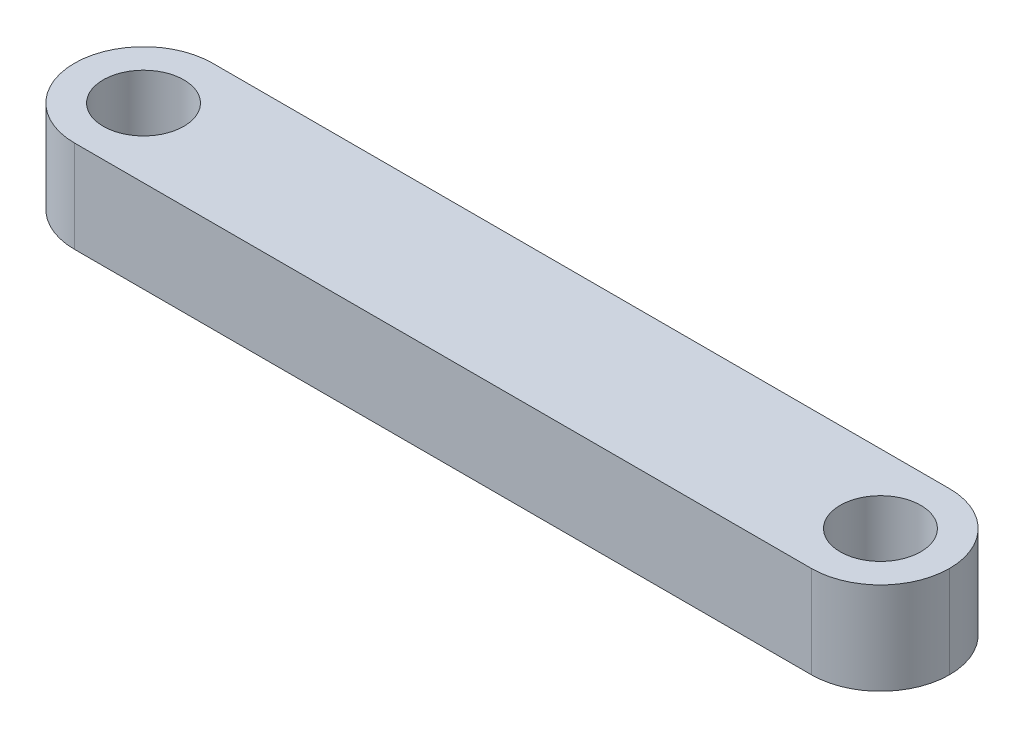
from build123d import *

# Parameters (mm, degrees)
CROQUIS1_W              = 38
CROQUIS1_H              = 6
CROQUIS1_R              = 1.75
SALIENTE_EXTRUIR1_DEPTH = 4
REDONDEO1_R             = 3


with BuildPart() as part:
    # Croquis1 → Saliente-Extruir1 (new body)
    with BuildSketch(Plane(origin=(0, 0, 0), x_dir=(1, 0, 0), z_dir=(0, 1, 0))):
        with Locations((19, 3)):
            Rectangle(CROQUIS1_W, CROQUIS1_H)
        with Locations(Location((3, 3, 0), (0, 0, 270))):
            Circle(CROQUIS1_R, mode=Mode.SUBTRACT)
        with Locations(Location((35, 3, 0), (0, 0, 270))):
            Circle(CROQUIS1_R, mode=Mode.SUBTRACT)
    extrude(amount=SALIENTE_EXTRUIR1_DEPTH)

    # Redondeo1
    redondeo1_edges = [part.edges().sort_by_distance(p)[0] for p in [
        (38, 2, -6),
        (38, 2, 0),
        (0, 2, -6),
        (0, 2, 0),
    ]]
    fillet(redondeo1_edges, radius=REDONDEO1_R - 0.0001)  # a hair under: the kernel refuses the full size


solid = part.part
